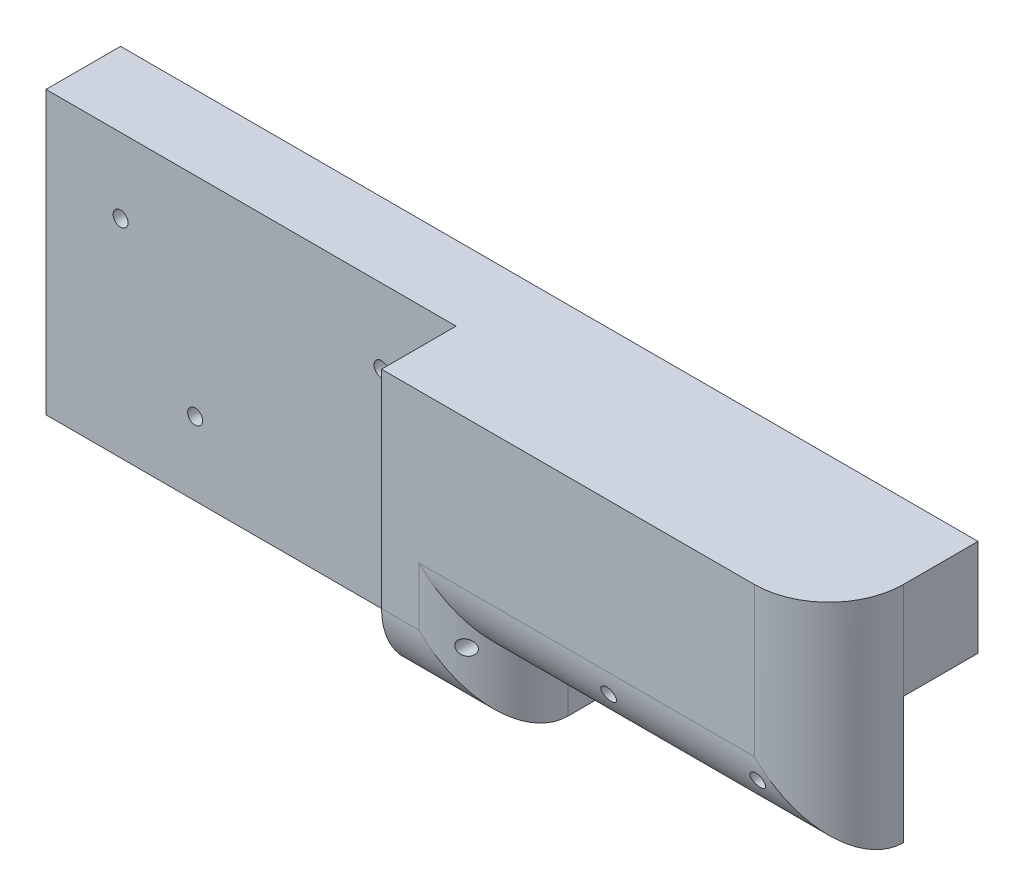
from build123d import *

# Parameters (mm, degrees)
ESQUISSE1_W             = 15
ESQUISSE1_H             = 7.802319197
BOSS_EXTRU_1_DEPTH      = 10
ESQUISSE2_W             = 55
ESQUISSE2_H             = 12.802319197
ESQUISSE2_W_2           = 40
ESQUISSE2_H_2           = 13
ESQUISSE2_H_3           = 25
BOSS_EXTRU_2_DEPTH      = 10
ESQUISSE3_W             = 60
ESQUISSE3_H             = 12.802319197
BOSS_EXTRU_3_DEPTH      = 10
CONG_1_R                = 10
ESQUISSE4_R             = 1
ENL_V_MAT_EXTRU_1_DEPTH = 276.282402739


with BuildPart() as part:
    # Esquisse1 → Boss.-Extru.1 (new body)
    with BuildSketch(Plane.XY.offset(40)):
        Polygon((-166.141434162, -130.464178298), (-121.141434162, -130.464178298), (-121.141434162, -100.464178298), (-181.141434162, -100.464178298), (-181.141434162, -130.464178298), align=None)
        with Locations((-173.641434162, -134.365337897)):
            Rectangle(ESQUISSE1_W, ESQUISSE1_H)
    extrude(amount=BOSS_EXTRU_1_DEPTH)

    # Esquisse2 → Boss.-Extru.2 (add)
    with BuildSketch(Plane(origin=(0, 0, 40), x_dir=(-1, 0, 0), z_dir=(0, 0, -1))):
        with Locations((208.641434162, -131.865337897)):
            Rectangle(ESQUISSE2_W, ESQUISSE2_H)
        Polygon((181.141434162, -138.266497495), (181.141434162, -125.464178298), (166.141434162, -125.464178298), (166.141434162, -130.464178298), (166.141434162, -138.266497495), align=None)
        Polygon((181.141434162, -100.464178298), (161.141434162, -100.464178298), (161.141434162, -113.464178298), (161.141434162, -125.464178298), (166.141434162, -125.464178298), (181.141434162, -125.464178298), align=None)
        with Locations((141.141434162, -106.964178298)):
            Rectangle(ESQUISSE2_W_2, ESQUISSE2_H_2)
        with Locations((208.641434162, -112.964178298)):
            Rectangle(ESQUISSE2_W, ESQUISSE2_H_3)
    extrude(amount=BOSS_EXTRU_2_DEPTH)

    # Esquisse3 → Boss.-Extru.3 (add)
    with BuildSketch(Plane(origin=(0, 0, 30), x_dir=(-1, 0, 0), z_dir=(0, 0, -1))):
        with Locations((196.141434162, -131.865337897)):
            Rectangle(ESQUISSE3_W, ESQUISSE3_H)
    extrude(amount=BOSS_EXTRU_3_DEPTH)

    # Congé1
    cong_1_edges = [part.edges().sort_by_distance(p)[0] for p in [
        (-121.141434162, -115.464178298, 50),
        (-173.641434162, -138.266497495, 50),
        (-166.141434162, -134.365337896, 50),
        (-143.641434162, -130.464178298, 50),
    ]]
    fillet(cong_1_edges, radius=CONG_1_R - 0.0001)  # a hair under: the kernel refuses the full size

    # Esquisse4 → Enlèv. mat.-Extru.1 (cut, through all)
    with BuildSketch(Plane.XY.offset(50)):
        with Locations((-151.141434162, -123.464178298)):
            Circle(ESQUISSE4_R)
        with Locations((-131.141434162, -123.464178298)):
            Circle(ESQUISSE4_R)
        with Locations((-171.141434162, -128.464178298)):
            Circle(ESQUISSE4_R)
        with Locations((-216.141434162, -128.464178298)):
            Circle(ESQUISSE4_R)
        with Locations(Location((-226.141434162, -110.464178298, 0), (0, 0, 180))):
            Circle(ESQUISSE4_R)
        with Locations(Location((-191.141434162, -110.464178298, 0), (0, 0, 180))):
            Circle(ESQUISSE4_R)
    extrude(amount=-ENL_V_MAT_EXTRU_1_DEPTH, mode=Mode.SUBTRACT)


solid = part.part
